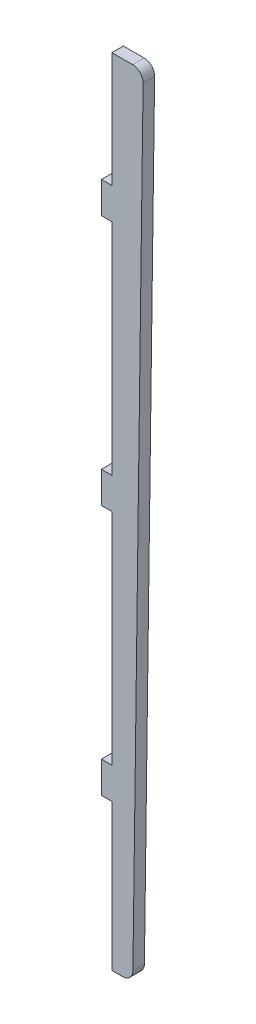
from build123d import *

# Parameters (mm, degrees)
BOSS_EXTRUDE1_DEPTH = 2.75
SKETCH1_4_W         = 5
SKETCH1_4_H         = 15
BOSS_EXTRUDE2_DEPTH = 2.75
LPATTERN1_COUNT     = 3
LPATTERN1_PITCH     = 120
FILLET1_R           = 5


with BuildPart() as part:
    # Sketch1 → Boss-Extrude1 (new, symmetric)
    with BuildSketch(Plane.XY):
        Polygon((0, 0), (0, -380), (10, -380), (15, 0), align=None)
    extrude(amount=BOSS_EXTRUDE1_DEPTH, both=True)

    # Sketch1<4> → Boss-Extrude2 (add, symmetric)
    with BuildSketch(Plane.XY):
        with Locations((-2.5, -62.5)):
            Rectangle(SKETCH1_4_W, SKETCH1_4_H)
    boss_extrude2 = extrude(amount=BOSS_EXTRUDE2_DEPTH, both=True)

    # LPattern1: Boss-Extrude2 ×3
    with Locations(*[(0, -i * LPATTERN1_PITCH, 0) for i in range(1, LPATTERN1_COUNT)]):
        add(boss_extrude2)

    # Fillet1
    fillet1_edges = [part.edges().sort_by_distance(p)[0] for p in [
        (10, -380, 0),
        (15, 0, 0),
    ]]
    fillet(fillet1_edges, radius=FILLET1_R)


solid = part.part
